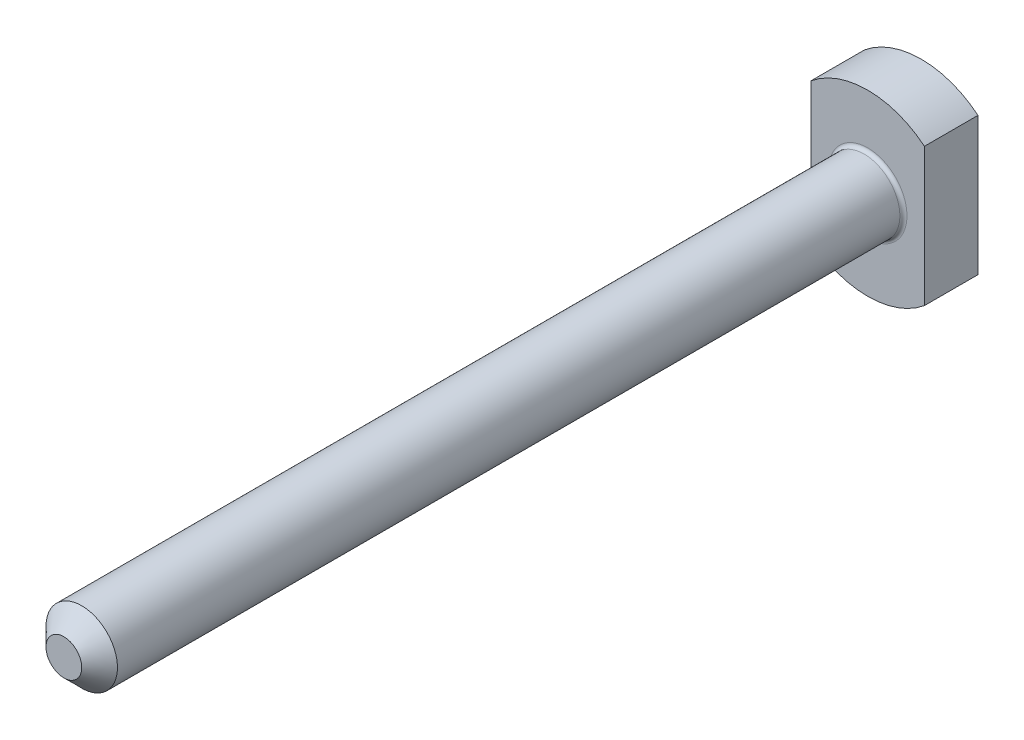
from build123d import *

# Parameters (mm, degrees)
SKETCH1_R           = 2
BOSS_EXTRUDE1_DEPTH = 45
BOSS_EXTRUDE2_DEPTH = 3
CHAMFER1_SIZE       = 1
FILLET1_R           = 0.2


with BuildPart() as part:
    # Sketch1 → Boss-Extrude1 (new body)
    with BuildSketch(Plane.XY):
        Circle(SKETCH1_R)
    extrude(amount=BOSS_EXTRUDE1_DEPTH)

    # Sketch2 → Boss-Extrude2 (add)
    with BuildSketch(Plane(origin=(0, 0, 0), x_dir=(-1, 0, 0), z_dir=(0, 0, -1))):
        with BuildLine():
            Line((-3.175, 3.862560679), (-3.175, -3.862560679))
            ThreePointArc((-3.175, -3.862560679), (0, -5), (3.175, -3.862560679))
            Line((3.175, -3.862560679), (3.175, 3.862560679))
            ThreePointArc((3.175, 3.862560679), (0, 5), (-3.175, 3.862560679))
        make_face()
    extrude(amount=BOSS_EXTRUDE2_DEPTH)

    # Chamfer1
    chamfer1_edges = [part.edges().sort_by_distance(p)[0] for p in [
        (-2, 0, 45),
    ]]
    chamfer(chamfer1_edges, length=CHAMFER1_SIZE)

    # Fillet1
    fillet1_edges = [part.edges().sort_by_distance(p)[0] for p in [
        (-2, 0, 0),
    ]]
    fillet(fillet1_edges, radius=FILLET1_R)


solid = part.part
